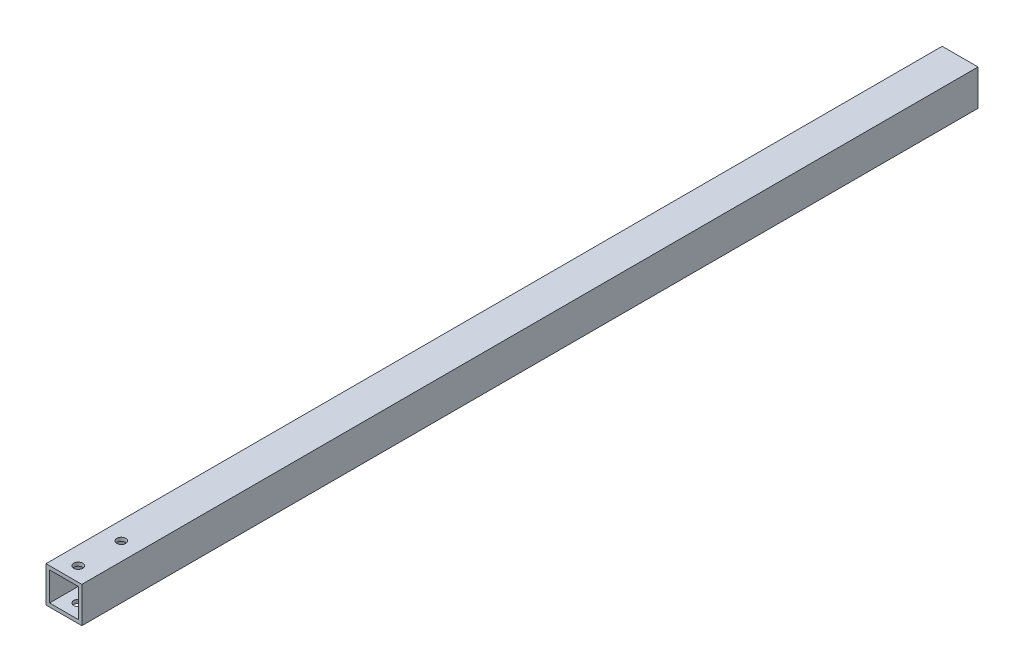
from build123d import *

# Parameters (mm, degrees)
SKETCH_1_W      = 10
SKETCH_1_H      = 10
SKETCH_1_W_2    = 8
SKETCH_1_H_2    = 8
EXTRUDE_1_DEPTH = 250
HOLE_WIZARD_1_D = 2.5


with BuildPart() as part:
    # 草图1 → 凸台-拉伸1 (new body)
    with BuildSketch(Plane.XY):
        Rectangle(SKETCH_1_W, SKETCH_1_H)
        Rectangle(SKETCH_1_W_2, SKETCH_1_H_2, mode=Mode.SUBTRACT)
    extrude(amount=EXTRUDE_1_DEPTH)

    # 孔1 (through all)
    with Locations(Plane(origin=(0, -5, 0), x_dir=(-1, 0, 0), z_dir=(0, -1, 0))):
        with Locations((0, -246), (0, -234)):
            Hole(HOLE_WIZARD_1_D / 2)


solid = part.part
